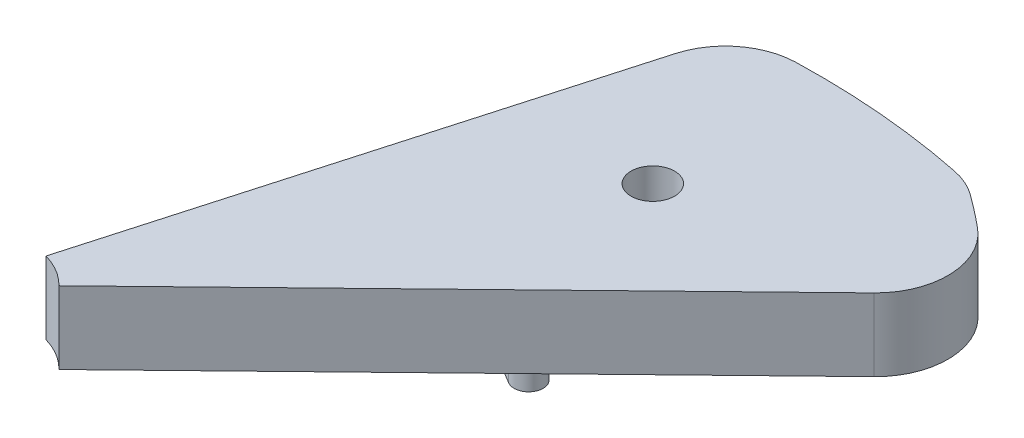
from build123d import *

# Parameters (mm, degrees)
BOSS_EXTRUDE1_DEPTH = 0.5
SKETCH2_R           = 0.15
CUT_EXTRUDE1_DEPTH  = 2
CUT_EXTRUDE2_START  = -0.5
CUT_EXTRUDE2_DEPTH  = 0.5
FILLET2_R           = 0.5
BOSS_EXTRUDE2_DEPTH = 0.2


# Read off the part's stored shape, not the designer's step: Cut-Extrude2
with BuildPart() as part:
    # Sketch1 → Boss-Extrude1 (new body)
    with BuildSketch(Plane(origin=(0, 0, 0), x_dir=(1, 0, 0), z_dir=(0, 1, 0))):
        with BuildLine():
            ThreePointArc((0.136751509, 0.480935572), (0.2565671, 0.429154195), (0.358898067, 0.348126669))
            Line((0.358898067, 0.348126669), (3.588980668, 3.48126669))
            ThreePointArc((3.588980668, 3.48126669), (2.565670997, 4.291541953), (1.367515087, 4.809355725))
            Line((1.367515087, 4.809355725), (0.136751509, 0.480935572))
        make_face()
    extrude(amount=BOSS_EXTRUDE1_DEPTH)

    # Sketch2 → Cut-Extrude1 (cut)
    with BuildSketch(Plane(origin=(0, 0, 0), x_dir=(1, 0, 0), z_dir=(0, 1, 0))):
        with Locations(Location((1.795969698, 3.004079367, 0), (0, 0, 270))):
            Circle(SKETCH2_R)
    extrude(amount=CUT_EXTRUDE1_DEPTH, mode=Mode.SUBTRACT)

    # Cut-Extrude2 outline → Cut-Extrude2 (cut)
    with BuildSketch(Plane(origin=(0, 0.5, 0), x_dir=(1, 0, 0), z_dir=(0, 1, 0)).offset(CUT_EXTRUDE2_START)):
        with BuildLine():
            ThreePointArc((1.193568814, 4.197611464), (2.034611336, 4.214092225), (2.867489845, 4.096034911))
            ThreePointArc((2.867489845, 4.096034911), (2.14732935, 4.515415447), (1.367515087, 4.809355725))
            Line((1.367515087, 4.809355725), (1.193568814, 4.197611464))
        make_face()
    extrude(amount=CUT_EXTRUDE2_DEPTH, mode=Mode.SUBTRACT)

    # Fillet2
    fillet2_edges = [part.edges().sort_by_distance(p)[0] for p in [
        (1.193568814, 0.25, -4.197611464),
        (2.867489845, 0.25, -4.096034911),
        (3.588980668, 0.25, -3.48126669),
    ]]
    fillet(fillet2_edges, radius=FILLET2_R)

    # Sketch4 → Boss-Extrude2 (add)
    with BuildSketch(Plane.XZ):
        with BuildLine():
            Line((0.930651433, -2.531084335), (1.788959824, -2.017950136))
            ThreePointArc((1.788959824, -2.017950136), (1.926104083, -2.052467555), (1.891586663, -2.189611814))
            Line((1.891586663, -2.189611814), (1.033278273, -2.702746013))
            ThreePointArc((1.033278273, -2.702746013), (0.896134014, -2.668228594), (0.930651433, -2.531084335))
        make_face()
    extrude(amount=BOSS_EXTRUDE2_DEPTH)


solid = part.part
